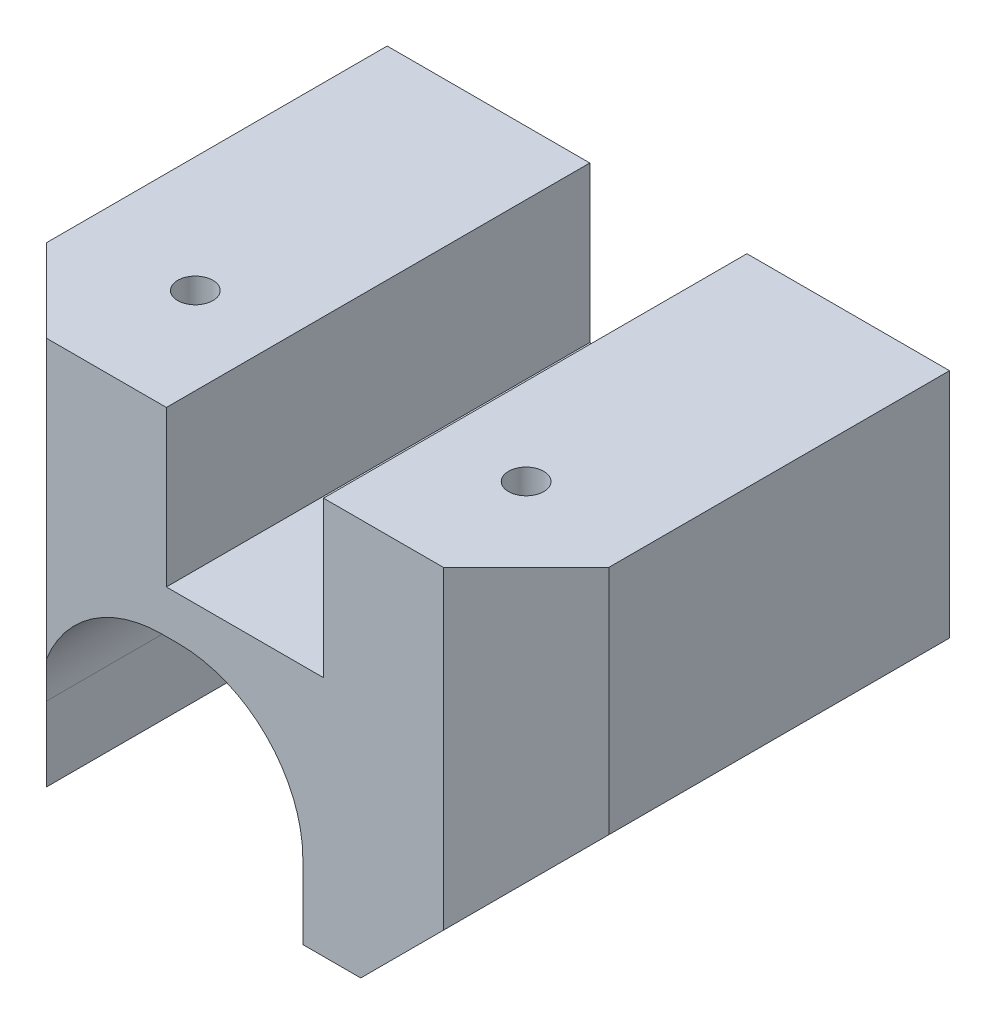
from build123d import *

# Parameters (mm, degrees)
SKETCH1_W                 = 43.18
SKETCH1_H                 = 32.512
BASE_DEPTH                = 30.48
SIDECHAMFER_SIZE          = 12.7
BACKCHAMFERS_SIZE         = 6.35
SKETCH2_W                 = 12.065
SKETCH2_H                 = 11.938
LINACTSLOT_DEPTH          = 50.519578391
MOUTINGHOLES_D            = 2.7051
MOUTINGHOLES_DEPTH        = 14.478
MOUTINGHOLES_TIP          = 0.81269403
MOTORSLOT_DEPTH           = 50.519578391
MOTORMOUNTINGHOLES2_D     = 2.2606
MOTORMOUNTINGHOLES2_DEPTH = 11.43
MOTORMOUNTINGHOLES2_TIP   = 0.679152758


with BuildPart() as part:
    # Sketch1 → Base (new body)
    with BuildSketch(Plane(origin=(0, 0, 0), x_dir=(1, 0, 0), z_dir=(0, 1, 0))):
        Rectangle(SKETCH1_W, SKETCH1_H)
    extrude(amount=BASE_DEPTH)

    # SideChamfer
    sidechamfer_edges = [part.edges().sort_by_distance(p)[0] for p in [
        (21.59, 0, 0),
    ]]
    chamfer(sidechamfer_edges, length=SIDECHAMFER_SIZE)

    # BackChamfers
    backchamfers_edges = [part.edges().sort_by_distance(p)[0] for p in [
        (-21.59, 15.24, 16.256),
        (21.59, 21.59, 16.256),
    ]]
    chamfer(backchamfers_edges, length=BACKCHAMFERS_SIZE)

    # Sketch2 → LinActSlot (cut, through all)
    with BuildSketch(Plane.XY.offset(16.256)):
        with Locations((0, 24.511)):
            Rectangle(SKETCH2_W, SKETCH2_H)
    extrude(amount=-LINACTSLOT_DEPTH, mode=Mode.SUBTRACT)

    # MoutingHoles
    with Locations(Plane(origin=(14.160350453, 30.48, 8.373414988), x_dir=(-1, 0, 0), z_dir=(0, 1, 0))):
        with Locations((1.460350453, -1.007414988), (26.860350453, -1.007414988)):
            Hole(MOUTINGHOLES_D / 2, depth=MOUTINGHOLES_DEPTH)
            with Locations((0, 0, -(MOUTINGHOLES_DEPTH + MOUTINGHOLES_TIP / 2))):  # 118° drill point
                Cone(0, MOUTINGHOLES_D / 2, MOUTINGHOLES_TIP, mode=Mode.SUBTRACT)

    # Sketch11 → MotorSlot (cut, through all)
    with BuildSketch(Plane(origin=(0, 0, -16.256), x_dir=(-1, 0, 0), z_dir=(0, 0, -1))):
        with BuildLine():
            Line((15.875, 5.08), (15.875, 5.715))
            ThreePointArc((15.875, 5.715), (13.085192091, 12.450192091), (6.35, 15.24))
            Line((6.35, 15.24), (5.08, 15.24))
            ThreePointArc((5.08, 15.24), (-1.655192091, 12.450192091), (-4.445, 5.715))
            Line((-4.445, 5.715), (-4.445, 5.08))
            Line((-4.445, 5.08), (-4.445, 0))
            Line((-4.445, 0), (15.875, 0))
            Line((15.875, 0), (15.875, 5.08))
        make_face()
    extrude(amount=-MOTORSLOT_DEPTH, mode=Mode.SUBTRACT)

    # MotorMountingHoles2
    with Locations(Plane(origin=(0, 0, -16.256), x_dir=(-1, 0, 0), z_dir=(0, 0, -1))):
        with Locations((18.2118, 5.715), (-6.7818, 5.715)):
            Hole(MOTORMOUNTINGHOLES2_D / 2, depth=MOTORMOUNTINGHOLES2_DEPTH)
            with Locations((0, 0, -(MOTORMOUNTINGHOLES2_DEPTH + MOTORMOUNTINGHOLES2_TIP / 2))):  # 118° drill point
                Cone(0, MOTORMOUNTINGHOLES2_D / 2, MOTORMOUNTINGHOLES2_TIP, mode=Mode.SUBTRACT)


solid = part.part
